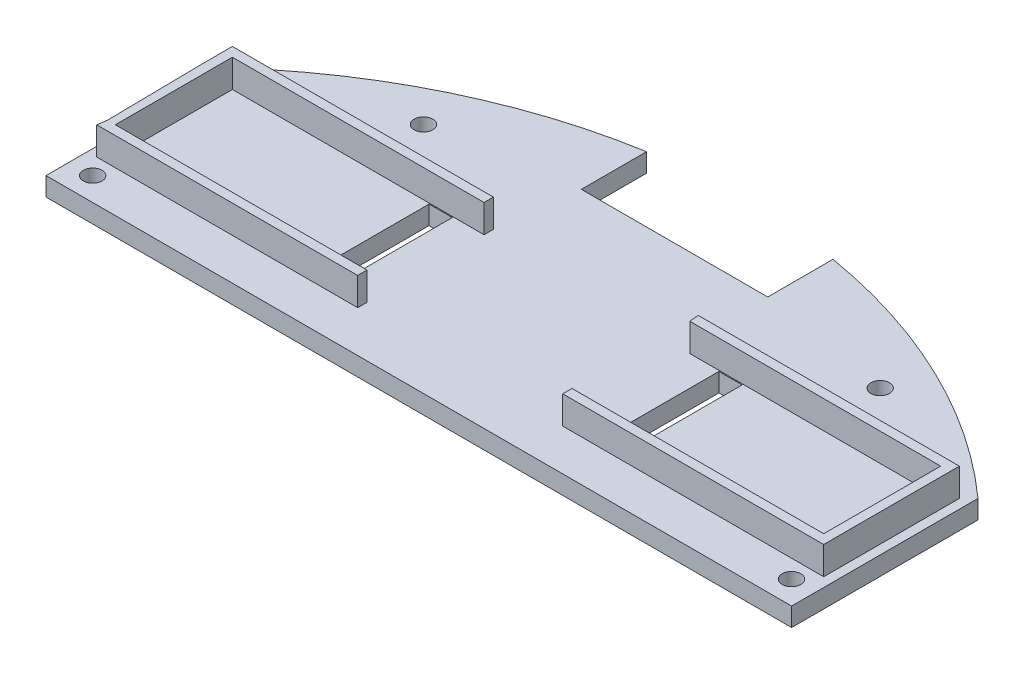
from build123d import *

# Parameters (mm, degrees)
SKETCH2_R           = 1
SKETCH2_W           = 2.5
SKETCH2_H           = 12.4
BOSS_EXTRUDE2_DEPTH = 2
BOSS_EXTRUDE3_DEPTH = 3


with BuildPart() as part:
    # Sketch2 → Boss-Extrude2 (new body)
    with BuildSketch(Plane(origin=(0, 0, 0), x_dir=(1, 0, 0), z_dir=(0, 1, 0))):
        with BuildLine():
            Line((-10, 24.439438281), (-10, 17.439438281))
            Line((-10, 17.439438281), (10, 17.439438281))
            Line((10, 17.439438281), (10, 24.439438281))
            ThreePointArc((10, 24.439438281), (26.021613026, 19.342266443), (40, 10))
            Line((40, 10), (40, -10))
            Line((40, -10), (-40, -10))
            Line((-40, -10), (-40, 10))
            ThreePointArc((-40, 10), (-26.021613026, 19.342266443), (-10, 24.439438281))
        make_face()
        with Locations((-37.490381057, -7.5)):
            Circle(SKETCH2_R, mode=Mode.SUBTRACT)
        with Locations((37.490381057, -7.5)):
            Circle(SKETCH2_R, mode=Mode.SUBTRACT)
        with Locations((-24.5, 15)):
            Circle(SKETCH2_R, mode=Mode.SUBTRACT)
        with Locations((24.5, 15)):
            Circle(SKETCH2_R, mode=Mode.SUBTRACT)
        with Locations((15.55, 1.7)):
            Rectangle(SKETCH2_W, SKETCH2_H, mode=Mode.SUBTRACT)
        with Locations((-15.55, 1.7)):
            Rectangle(SKETCH2_W, SKETCH2_H, mode=Mode.SUBTRACT)
    extrude(amount=BOSS_EXTRUDE2_DEPTH)

    # Sketch3 → Boss-Extrude3 (add)
    with BuildSketch(Plane(origin=(0, 2, 0), x_dir=(1, 0, 0), z_dir=(0, 1, 0))):
        Polygon((11, -4.558225), (38, -4.558225), (38, 8), (11.07133758, 8.002547771), (11, 9), (28.215294967, 9), (39, 9), (39, -5.558225), (38, -5.558225), (11, -5.558225), align=None)
        Polygon((-38.849444194, -4.569623577), (-39, -5.558225089), (-11, -5.558225089), (-11, -4.558225193), (-38, -4.558225193), (-38, 8), (-11, 8), (-11, 9), (-39, 9), (-39, 5.9), align=None)
    extrude(amount=BOSS_EXTRUDE3_DEPTH)


solid = part.part
